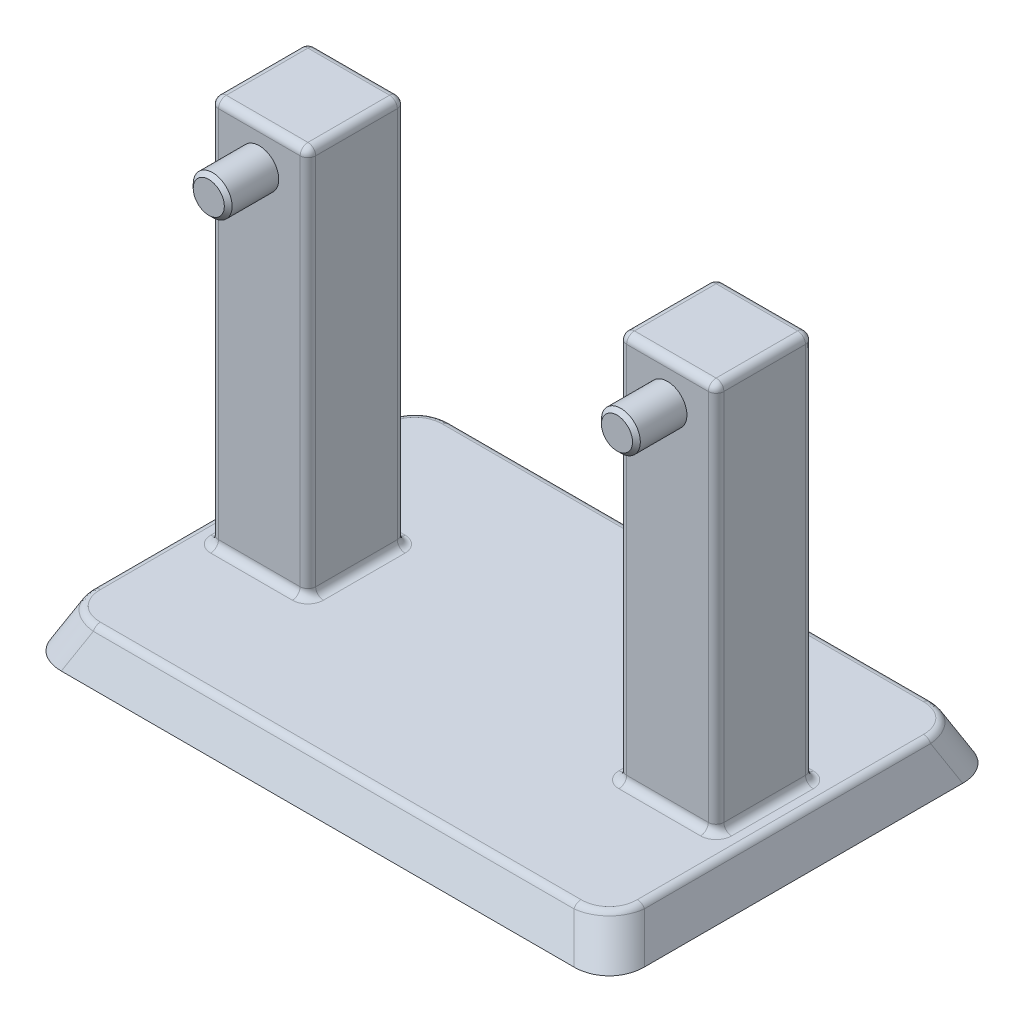
from build123d import *

# Parameters (mm, degrees)
SKICA1_W                = 150
SKICA1_H                = 100
P_IDAT_VYSUNUT_M1_DEPTH = 10
P_IDAT_VYSUNUT_M1_TAPER = 25
SKO_EPINA1_T            = -3
SKICA2_W                = 25
SKICA2_H                = 25
P_IDAT_VYSUNUT_M2_DEPTH = 100
SKICA3_R                = 5
P_IDAT_VYSUNUT_M3_DEPTH = 13
ZAOBLIT1_R              = 10
ZAOBLIT2_R              = 2
ZAOBLIT3_R              = 2
ZAOBLIT4_R              = 2
ZKOSEN_1_SIZE           = 1


with BuildPart() as part:
    # Skica1 → Přidat vysunutím1 (new body)
    with BuildSketch(Plane(origin=(0, 0, 0), x_dir=(1, 0, 0), z_dir=(0, 1, 0))):
        Rectangle(SKICA1_W, SKICA1_H)
    extrude(amount=P_IDAT_VYSUNUT_M1_DEPTH, taper=P_IDAT_VYSUNUT_M1_TAPER)

    # Skořepina1
    sko_epina1_openings = [part.faces().sort_by_distance(p)[0] for p in [
        (0, 0, 0),
    ]]
    offset(amount=SKO_EPINA1_T, openings=sko_epina1_openings, kind=Kind.INTERSECTION)

    # Skica2 → Přidat vysunutím2 (add)
    with BuildSketch(Plane(origin=(0, 10, 0), x_dir=(1, 0, 0), z_dir=(0, 1, 0))):
        with Locations((52.5, 0)):
            Rectangle(SKICA2_W, SKICA2_H)
    p_idat_vysunut_m2 = extrude(amount=P_IDAT_VYSUNUT_M2_DEPTH)

    # Skica3 → Přidat vysunutím3 (add)
    with BuildSketch(Plane.XY.offset(12.5)):
        with Locations((52.5, 100)):
            Circle(SKICA3_R)
    p_idat_vysunut_m3 = extrude(amount=P_IDAT_VYSUNUT_M3_DEPTH)

    # Zrcadlit1: Přidat vysunutím2, Přidat vysunutím3 across plane
    add(p_idat_vysunut_m2.mirror(Plane(origin=(0, 0, 0), x_dir=(0, 0, 1), z_dir=(1, 0, 0))))
    add(p_idat_vysunut_m3.mirror(Plane(origin=(0, 0, 0), x_dir=(0, 0, 1), z_dir=(1, 0, 0))))

    # Zaoblit1
    zaoblit1_edges = [part.edges().sort_by_distance(p)[0] for p in [
        (-72.668461709, 5, 47.668461709),
        (-72.668461709, 5, -47.668461709),
        (72.668461709, 5, -47.668461709),
        (72.668461709, 5, 47.668461709),
    ]]
    fillet(zaoblit1_edges, radius=ZAOBLIT1_R)

    # Zaoblit2
    zaoblit2_edges = [part.edges().sort_by_distance(p)[0] for p in [
        (0, 10, 45.336923418),
        (-67.773343943, 10, 42.773343943),
        (-70.336923418, 10, 0),
        (-67.773343943, 10, -42.773343943),
        (0, 10, -45.336923418),
        (67.773343943, 10, -42.773343943),
        (70.336923418, 10, 0),
        (67.773343943, 10, 42.773343943),
    ]]
    fillet(zaoblit2_edges, radius=ZAOBLIT2_R)

    # Zaoblit3
    zaoblit3_edges = [part.edges().sort_by_distance(p)[0] for p in [
        (65, 60, -12.5),
        (40, 60, -12.5),
        (40, 60, 12.5),
        (65, 60, 12.5),
        (-40, 60, -12.5),
        (-65, 60, -12.5),
        (-65, 60, 12.5),
        (-40, 60, 12.5),
    ]]
    fillet(zaoblit3_edges, radius=ZAOBLIT3_R)

    # Zaoblit4
    zaoblit4_edges = [part.edges().sort_by_distance(p)[0] for p in [
        (-40.585786438, 110, -11.914213562),
        (-52.5, 110, -12.5),
        (-64.414213562, 110, -11.914213562),
        (-65, 110, 0),
        (-64.414213562, 110, 11.914213562),
        (-52.5, 110, 12.5),
        (-40.585786438, 110, 11.914213562),
        (64.414213562, 110, 11.914213562),
        (52.5, 110, 12.5),
        (40.585786438, 110, 11.914213562),
        (40, 110, 0),
        (40.585786438, 110, -11.914213562),
        (52.5, 110, -12.5),
        (64.414213562, 110, -11.914213562),
        (64.414213562, 10, 11.914213562),
        (52.5, 10, 12.5),
        (40.585786438, 10, 11.914213562),
        (40, 10, 0),
        (40.585786438, 10, -11.914213562),
        (52.5, 10, -12.5),
        (64.414213562, 10, -11.914213562),
        (-40.585786438, 10, -11.914213562),
        (-52.5, 10, -12.5),
        (-64.414213562, 10, -11.914213562),
        (-65, 10, 0),
        (-64.414213562, 10, 11.914213562),
        (-52.5, 10, 12.5),
        (-40.585786438, 10, 11.914213562),
        (-40, 110, 0),
        (65, 110, 0),
        (65, 10, 0),
        (-40, 10, 0),
    ]]
    fillet(zaoblit4_edges, radius=ZAOBLIT4_R)

    # Zkosení1
    zkosen_1_edges = [part.edges().sort_by_distance(p)[0] for p in [
        (47.5, 100, 25.5),
        (-47.5, 100, 25.5),
    ]]
    chamfer(zkosen_1_edges, length=ZKOSEN_1_SIZE)


solid = part.part
